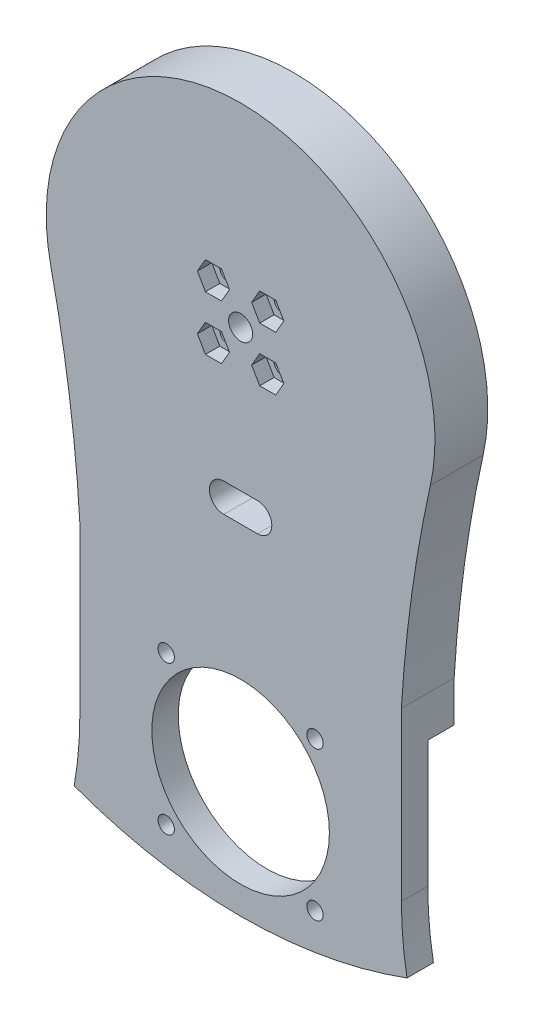
from build123d import *

# Parameters (mm, degrees)
SKETCH1_R           = 18.5
BOSS_EXTRUDE1_DEPTH = 5.5
SKETCH2_R           = 1.7
SKETCH2_R_2         = 2.5
BOSS_EXTRUDE2_DEPTH = 11
SKETCH3_R           = 1.7
CUT_EXTRUDE1_DEPTH  = 134.376282332
CUT_EXTRUDE11_DEPTH = 10
CUT_EXTRUDE12_DEPTH = 3
CUT_EXTRUDE13_DEPTH = 130.489381804


with BuildPart() as part:
    # Sketch1 → Boss-Extrude1 (new body)
    with BuildSketch(Plane.XY):
        with BuildLine():
            Line((-33.5, 21.5), (-33.5, -4.850925931))
            ThreePointArc((-33.5, -4.850925931), (-38.168927278, -30.899730314), (-51.594405594, -53.705335408))
            ThreePointArc((-51.594405594, -53.705335408), (0, -30), (51.594405594, -53.705335408))
            ThreePointArc((51.594405594, -53.705335408), (38.168927278, -30.899730314), (33.5, -4.850925931))
            Line((33.5, -4.850925931), (33.5, 21.5))
            Line((33.5, 21.5), (-33.5, 21.5))
        make_face()
        Circle(SKETCH1_R, mode=Mode.SUBTRACT)
    extrude(amount=BOSS_EXTRUDE1_DEPTH)

    # Sketch2 → Boss-Extrude2 (add)
    with BuildSketch(Plane.XY.offset(5.5)):
        with BuildLine():
            Line((-33.5, 30), (-33.5, 21.5))
            Line((-33.5, 21.5), (33.5, 21.5))
            Line((33.5, 21.5), (33.5, 30))
            ThreePointArc((33.5, 30), (35.66625593, 51.742394188), (39.542569928, 73.245848783))
            ThreePointArc((39.542569928, 73.245848783), (0, 122.5), (-39.542569928, 73.245848783))
            ThreePointArc((-39.542569928, 73.245848783), (-35.66625593, 51.742394188), (-33.5, 30))
        make_face()
        with Locations((-5.656854249, 76.343145751)):
            Circle(SKETCH2_R, mode=Mode.SUBTRACT)
        with Locations((-5.656854249, 87.656854249)):
            Circle(SKETCH2_R, mode=Mode.SUBTRACT)
        with Locations((5.656854249, 76.343145751)):
            Circle(SKETCH2_R, mode=Mode.SUBTRACT)
        with Locations((0, 82)):
            Circle(SKETCH2_R_2, mode=Mode.SUBTRACT)
        with Locations((5.656854249, 87.656854249)):
            Circle(SKETCH2_R, mode=Mode.SUBTRACT)
    extrude(amount=-BOSS_EXTRUDE2_DEPTH)

    # Sketch3 → Cut-Extrude1 (cut, through all)
    with BuildSketch(Plane.XY.offset(5.5)):
        with Locations((-15.5, 15.5)):
            Circle(SKETCH3_R)
        with Locations((15.5, 15.5)):
            Circle(SKETCH3_R)
        with Locations((15.5, -15.5)):
            Circle(SKETCH3_R)
        with Locations((-15.5, -15.5)):
            Circle(SKETCH3_R)
    extrude(amount=-CUT_EXTRUDE1_DEPTH, mode=Mode.SUBTRACT)

    # Sketch4 → Cut-Extrude11 (cut)
    with BuildSketch(Plane(origin=(0, 0, 0), x_dir=(-1, 0, 0), z_dir=(0, 0, -1))):
        with BuildLine():
            ThreePointArc((33.5, -18.5), (0, -24.278187239), (-33.5, -18.5))
            ThreePointArc((-33.5, -18.5), (-34.088098429, -18.288833154), (-34.674865885, -18.073995652))
            ThreePointArc((-34.674865885, -18.073995652), (-40.75024769, -37.021892063), (-51.594405594, -53.705335408))
            ThreePointArc((-51.594405594, -53.705335408), (0, -30), (51.594405594, -53.705335408))
            ThreePointArc((51.594405594, -53.705335408), (40.75024769, -37.021892063), (34.674865885, -18.073995652))
            ThreePointArc((34.674865885, -18.073995652), (34.088098429, -18.288833154), (33.5, -18.5))
        make_face()
    extrude(amount=-CUT_EXTRUDE11_DEPTH, mode=Mode.SUBTRACT)

    # Sketch5 → Cut-Extrude12 (cut)
    with BuildSketch(Plane.XY.offset(5.5)):
        Polygon((-7.331854249, 90.558039352), (-3.981854249, 90.558039352), (-2.306854249, 87.656854249), (-3.981854249, 84.755669147), (-7.331854249, 84.755669147), (-9.006854249, 87.656854249), align=None)
        Polygon((3.981854249, 90.558039352), (7.331854249, 90.558039352), (9.006854249, 87.656854249), (7.331854249, 84.755669147), (3.981854249, 84.755669147), (2.306854249, 87.656854249), align=None)
        Polygon((-7.331854249, 79.244330853), (-9.006854249, 76.343145751), (-7.331854249, 73.441960648), (-3.981854249, 73.441960648), (-2.306854249, 76.343145751), (-3.981854249, 79.244330853), align=None)
        Polygon((3.981854249, 79.244330853), (7.331854249, 79.244330853), (9.006854249, 76.343145751), (7.331854249, 73.441960648), (3.981854249, 73.441960648), (2.306854249, 76.343145751), align=None)
    extrude(amount=-CUT_EXTRUDE12_DEPTH, mode=Mode.SUBTRACT)

    # Sketch6 → Cut-Extrude13 (cut, through all)
    with BuildSketch(Plane(origin=(0, 0, -5.5), x_dir=(-1, 0, 0), z_dir=(0, 0, -1))):
        with BuildLine():
            Line((3.5, 46.5), (-3.5, 46.5))
            ThreePointArc((-3.5, 46.5), (-6.5, 49.5), (-3.5, 52.5))
            Line((-3.5, 52.5), (3.5, 52.5))
            ThreePointArc((3.5, 52.5), (6.5, 49.5), (3.5, 46.5))
        make_face()
    extrude(amount=-CUT_EXTRUDE13_DEPTH, mode=Mode.SUBTRACT)


solid = part.part
